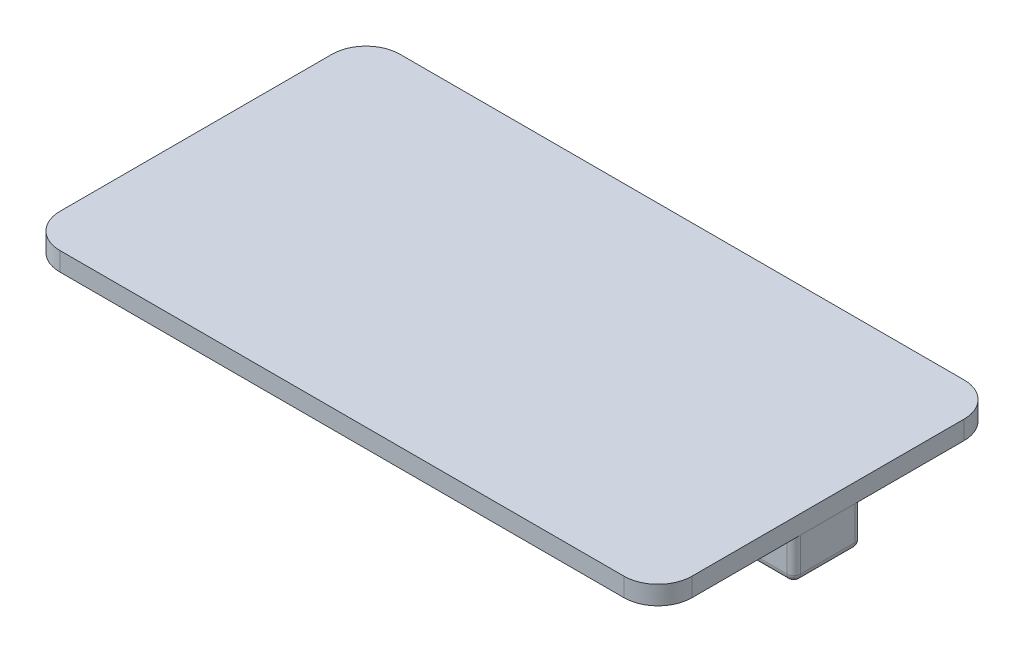
from build123d import *

# Parameters (mm, degrees)
SKETCH_1_W          = 186
SKETCH_1_H          = 20
EXTRUDE_1_DEPTH     = 14
SKETCH_2_W          = 186
SKETCH_2_H          = 20
CUT_EXTRUDE_2_DEPTH = 2
SKETCH_3_W          = 177
SKETCH_3_H          = 11
CUT_EXTRUDE_3_DEPTH = 4
SKETCH_4_R          = 2.75
CUT_EXTRUDE_6_DEPTH = 5.5
SKETCH_5_W          = 185.880265185
SKETCH_5_H          = 100
EXTRUDE_2_DEPTH     = 5.5
FILLET_1_R          = 10
FILLET_2_R          = 10
FILLET_3_R          = 10
FILLET_4_R          = 10
FILLET_6_R          = 2
FILLET_7_R          = 2
FILLET_8_R          = 2
FILLET_9_R          = 2


with BuildPart() as part:
    # 草图1 → 凸台-拉伸1 (new body)
    with BuildSketch(Plane(origin=(0, 0, 0), x_dir=(1, 0, 0), z_dir=(0, 1, 0))):
        Rectangle(SKETCH_1_W, SKETCH_1_H)
    extrude(amount=EXTRUDE_1_DEPTH)

    # 草图2 → 切除-拉伸2 (cut)
    with BuildSketch(Plane(origin=(0, 14, 0), x_dir=(1, 0, 0), z_dir=(0, 1, 0))):
        Rectangle(SKETCH_2_W, SKETCH_2_H)
    extrude(amount=-CUT_EXTRUDE_2_DEPTH, mode=Mode.SUBTRACT)

    # 草图3 → 切除-拉伸3 (cut)
    with BuildSketch(Plane.XZ):
        Rectangle(SKETCH_3_W, SKETCH_3_H)
    extrude(amount=-CUT_EXTRUDE_3_DEPTH, mode=Mode.SUBTRACT)

    # 草图4 → 切除-拉伸6 (cut)
    with BuildSketch(Plane.XZ.offset(-4)):
        with Locations(Location((-72, 0, 0), (0, 0, 270))):
            Circle(SKETCH_4_R)
        with Locations(Location((-38, 0, 0), (0, 0, 270))):
            Circle(SKETCH_4_R)
        with Locations(Location((38, 0, 0), (0, 0, 270))):
            Circle(SKETCH_4_R)
        with Locations(Location((72, 0, 0), (0, 0, 270))):
            Circle(SKETCH_4_R)
    extrude(amount=-CUT_EXTRUDE_6_DEPTH, mode=Mode.SUBTRACT)

    # 草图5 → 凸台-拉伸2 (add)
    with BuildSketch(Plane(origin=(0, 12, 0), x_dir=(1, 0, 0), z_dir=(0, 1, 0))):
        with Locations((0.140286992, 0)):
            Rectangle(SKETCH_5_W, SKETCH_5_H)
    extrude(amount=EXTRUDE_2_DEPTH)

    # 圆角1
    fillet_1_edges = [part.edges().sort_by_distance(p)[0] for p in [
        (-92.7998456, 14.75, 50),
    ]]
    fillet(fillet_1_edges, radius=FILLET_1_R)

    # 圆角2
    fillet_2_edges = [part.edges().sort_by_distance(p)[0] for p in [
        (93.080419585, 14.75, 50),
    ]]
    fillet(fillet_2_edges, radius=FILLET_2_R)

    # 圆角3
    fillet_3_edges = [part.edges().sort_by_distance(p)[0] for p in [
        (93.080419585, 14.75, -50),
    ]]
    fillet(fillet_3_edges, radius=FILLET_3_R)

    # 圆角4
    fillet_4_edges = [part.edges().sort_by_distance(p)[0] for p in [
        (-92.7998456, 14.75, -50),
    ]]
    fillet(fillet_4_edges, radius=FILLET_4_R)

    # 圆角6
    fillet_6_edges = [part.edges().sort_by_distance(p)[0] for p in [
        (0, 0, -10),
    ]]
    fillet(fillet_6_edges, radius=FILLET_6_R)

    # 圆角7
    fillet_7_edges = [part.edges().sort_by_distance(p)[0] for p in [
        (0, 0, 10),
    ]]
    fillet(fillet_7_edges, radius=FILLET_7_R)

    # 圆角8
    # the kernel refuses this fillet: 2 mm, written as the material it takes off along each edge
    with BuildSketch(Plane(origin=(-93, 0, 8), x_dir=(1, 0, 0), z_dir=(0, 0, -1))) as fillet_8_piece_1:
        with BuildLine():
            CenterArc((FILLET_8_R, -FILLET_8_R), FILLET_8_R, 90, 90)
            Line((0, -FILLET_8_R), (0, 0))
            Line((0, 0), (FILLET_8_R, 0))
        make_face()
    extrude(amount=16, mode=Mode.SUBTRACT)
    with BuildSketch(Plane(origin=(-93, 2, -8), x_dir=(0, 0, -1), z_dir=(0, 1, 0))) as fillet_8_piece_2:
        with BuildLine():
            CenterArc((2 - FILLET_8_R, -FILLET_8_R), FILLET_8_R, 0, 90)
            Line((2 - FILLET_8_R, 0), (2, 0))
            Line((2, 0), (2, -FILLET_8_R))
        make_face()
    revolve(axis=Axis((-93, 2, -8), (-1, 0, 0)), revolution_arc=90, mode=Mode.SUBTRACT)
    with BuildSketch(Plane(origin=(-93, 2, 8), x_dir=(0, -1, 0), z_dir=(0, 0, -1))) as fillet_8_piece_3:
        with BuildLine():
            CenterArc((2 - FILLET_8_R, -FILLET_8_R), FILLET_8_R, 0, 90)
            Line((2 - FILLET_8_R, 0), (2, 0))
            Line((2, 0), (2, -FILLET_8_R))
        make_face()
    revolve(axis=Axis((-93, 2, 8), (-1, 0, 0)), revolution_arc=90, mode=Mode.SUBTRACT)
    with BuildSketch(Plane(origin=(-93, 2, 10), x_dir=(1, 0, 0), z_dir=(0, 1, 0))) as fillet_8_piece_4:
        with BuildLine():
            CenterArc((FILLET_8_R, FILLET_8_R), FILLET_8_R, 180, 90)
            Line((0, FILLET_8_R), (0, 0))
            Line((0, 0), (FILLET_8_R, 0))
        make_face()
    extrude(amount=10, mode=Mode.SUBTRACT)
    with BuildSketch(Plane(origin=(-93, 2, -10), x_dir=(1, 0, 0), z_dir=(0, 1, 0))) as fillet_8_piece_5:
        with BuildLine():
            CenterArc((FILLET_8_R, -FILLET_8_R), FILLET_8_R, 90, 90)
            Line((0, -FILLET_8_R), (0, 0))
            Line((0, 0), (FILLET_8_R, 0))
        make_face()
    extrude(amount=10, mode=Mode.SUBTRACT)

    # 圆角9
    fillet_9_edges = [part.edges().sort_by_distance(p)[0] for p in [
        (93, 0, 0),
        (93, 0.585786438, -9.414213562),
        (93, 0.585786438, 9.414213562),
        (93, 7, -10),
        (93, 7, 10),
    ]]
    fillet(fillet_9_edges, radius=FILLET_9_R)


solid = part.part
